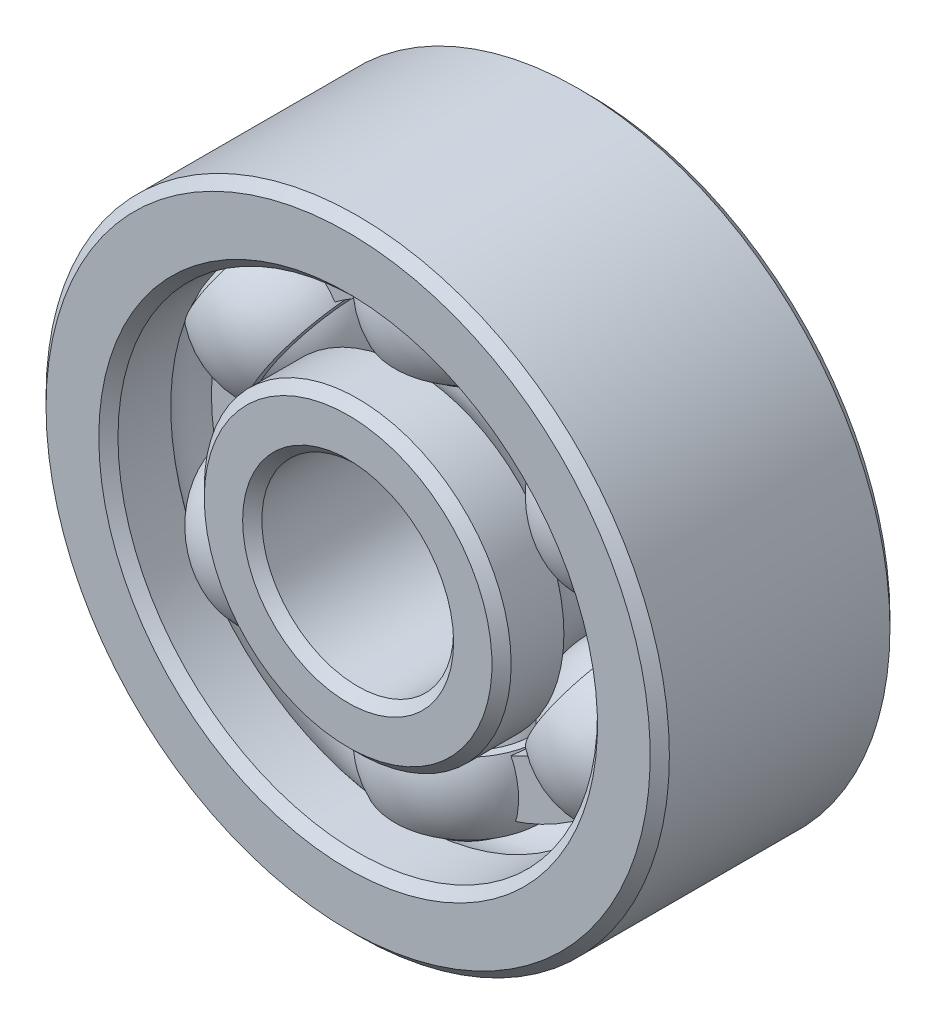
from build123d import *

# Parameters (mm, degrees)
CIRPATTERN1_COUNT = 6
CIRPATTERN2_COUNT = 6
EXTRUDE1_DEPTH    = 0.55
CIRPATTERN4_COUNT = 6
CHAMFER1_SIZE     = 0.2
CHAMFER_1_SIZE    = 0.2


with BuildPart() as part:
    # Sketch1 → Revolve1 (revolve)
    with BuildSketch(Plane(origin=(0, 0, 0), x_dir=(0, 0, -1), z_dir=(1, 0, 0))):
        with BuildLine():
            Line((-2.5, 6.5), (2.5, 6.5))
            Line((2.5, 6.5), (2.5, 5))
            Line((2.5, 5), (1.2, 5))
            ThreePointArc((1.2, 5), (0, 5.6), (-1.2, 5))
            Line((-1.2, 5), (-2.5, 5))
            Line((-2.5, 5), (-2.5, 6.5))
        make_face()
        with BuildLine():
            Line((-2.5, 3.2), (-1.2, 3.2))
            ThreePointArc((-1.2, 3.2), (0, 2.6), (1.2, 3.2))
            Line((1.2, 3.2), (2.5, 3.2))
            Line((2.5, 3.2), (2.5, 2))
            Line((2.5, 2), (-2.5, 2))
            Line((-2.5, 2), (-2.5, 3.2))
        make_face()
    revolve(axis=Axis((0, 0, 0), (0, 0, -1)))

    # Chamfer1
    chamfer1_edges = [part.edges().sort_by_distance(p)[0] for p in [
        (0, -2, -2.5),
        (0, -3.2, -2.5),
        (0, -3.2, 2.5),
        (0, -2, 2.5),
    ]]
    chamfer(chamfer1_edges, length=CHAMFER1_SIZE)

    # Фаска1
    chamfer_1_edges = [part.edges().sort_by_distance(p)[0] for p in [
        (0, -6.5, 2.5),
        (0, -5, 2.5),
        (0, -5, -2.5),
        (0, -6.5, -2.5),
    ]]
    chamfer(chamfer_1_edges, length=CHAMFER_1_SIZE)


with BuildPart() as body_2:
    # Sketch2 → Revolve2 (revolve)
    with BuildSketch(Plane(origin=(0, 0, 0), x_dir=(0, 0, -1), z_dir=(1, 0, 0))):
        with BuildLine():
            Line((0, 2.5873), (0, 5.6127))
            ThreePointArc((0, 5.6127), (1.5127, 4.1), (0, 2.5873))
        make_face()
    revolve(axis=Axis((0, 2.5873, 0), (0, 1, 0)))


with BuildPart() as cirpattern1_1:
    # CirPattern1: pattern copy
    add(body_2.part.rotate(Axis((0, 0, 0), (0, 0, 1)), 1 * 360 / CIRPATTERN1_COUNT))


with BuildPart() as cirpattern1_2:
    # CirPattern1: pattern copy
    add(body_2.part.rotate(Axis((0, 0, 0), (0, 0, 1)), 2 * 360 / CIRPATTERN1_COUNT))


with BuildPart() as cirpattern1_3:
    # CirPattern1: pattern copy
    add(body_2.part.rotate(Axis((0, 0, 0), (0, 0, 1)), 3 * 360 / CIRPATTERN1_COUNT))


with BuildPart() as cirpattern1_4:
    # CirPattern1: pattern copy
    add(body_2.part.rotate(Axis((0, 0, 0), (0, 0, 1)), 4 * 360 / CIRPATTERN1_COUNT))


with BuildPart() as cirpattern1_5:
    # CirPattern1: pattern copy
    add(body_2.part.rotate(Axis((0, 0, 0), (0, 0, 1)), 5 * 360 / CIRPATTERN1_COUNT))


with BuildPart() as body_8:
    # Sketch3 → Revolve3 (revolve)
    with BuildSketch(Plane(origin=(0, 0, 0), x_dir=(0, 0, -1), z_dir=(1, 0, 0))):
        with BuildLine():
            Line((1.356465997, 3.35), (1.52561463, 3.35))
            ThreePointArc((1.52561463, 3.35), (1.7, 4.1), (1.52561463, 4.85))
            Line((1.52561463, 4.85), (1.356465997, 4.85))
            ThreePointArc((1.356465997, 4.85), (1.55, 4.1), (1.356465997, 3.35))
        make_face()
    revolve(axis=Axis((0, 6.5, 0), (0, -1, 0)))


with BuildPart() as cirpattern2_1:
    # CirPattern2: pattern copy
    add(body_8.part.rotate(Axis((0, 0, 0), (0, 0, 1)), 1 * 360 / CIRPATTERN2_COUNT))


with BuildPart() as cirpattern2_2:
    # CirPattern2: pattern copy
    add(body_8.part.rotate(Axis((0, 0, 0), (0, 0, 1)), 2 * 360 / CIRPATTERN2_COUNT))


with BuildPart() as cirpattern2_3:
    # CirPattern2: pattern copy
    add(body_8.part.rotate(Axis((0, 0, 0), (0, 0, 1)), 3 * 360 / CIRPATTERN2_COUNT))


with BuildPart() as cirpattern2_4:
    # CirPattern2: pattern copy
    add(body_8.part.rotate(Axis((0, 0, 0), (0, 0, 1)), 4 * 360 / CIRPATTERN2_COUNT))


with BuildPart() as cirpattern2_5:
    # CirPattern2: pattern copy
    add(body_8.part.rotate(Axis((0, 0, 0), (0, 0, 1)), 5 * 360 / CIRPATTERN2_COUNT))


with BuildPart() as body_14:
    # Sketch5 → Extrude1 (new, symmetric)
    with BuildSketch(Plane.XY):
        with BuildLine():
            ThreePointArc((-1.4342904, 4.580699843), (-2.4, 4.156921938), (-3.249857231, 3.532481844))
            ThreePointArc((-3.249857231, 3.532481844), (-2.712261575, 3.309077174), (-2.298849246, 2.899188187))
            ThreePointArc((-2.298849246, 2.899188187), (-1.85, 3.204293994), (-1.361345997, 3.44045594))
            ThreePointArc((-1.361345997, 3.44045594), (-1.509614108, 4.003426013), (-1.4342904, 4.580699843))
        make_face()
    extrude(amount=EXTRUDE1_DEPTH, both=True)


with BuildPart() as cirpattern4_1:
    # CirPattern4: pattern copy
    add(body_14.part.rotate(Axis((0, 0, 0), (0, 0, -1)), 1 * 360 / CIRPATTERN4_COUNT))


with BuildPart() as cirpattern4_2:
    # CirPattern4: pattern copy
    add(body_14.part.rotate(Axis((0, 0, 0), (0, 0, -1)), 2 * 360 / CIRPATTERN4_COUNT))


with BuildPart() as cirpattern4_3:
    # CirPattern4: pattern copy
    add(body_14.part.rotate(Axis((0, 0, 0), (0, 0, -1)), 3 * 360 / CIRPATTERN4_COUNT))


with BuildPart() as cirpattern4_4:
    # CirPattern4: pattern copy
    add(body_14.part.rotate(Axis((0, 0, 0), (0, 0, -1)), 4 * 360 / CIRPATTERN4_COUNT))


with BuildPart() as cirpattern4_5:
    # CirPattern4: pattern copy
    add(body_14.part.rotate(Axis((0, 0, 0), (0, 0, -1)), 5 * 360 / CIRPATTERN4_COUNT))


solid = Compound([part.part, body_2.part, cirpattern1_1.part, cirpattern1_2.part, cirpattern1_3.part, cirpattern1_4.part, cirpattern1_5.part, body_8.part, cirpattern2_1.part, cirpattern2_2.part, cirpattern2_3.part, cirpattern2_4.part, cirpattern2_5.part, body_14.part, cirpattern4_1.part, cirpattern4_2.part, cirpattern4_3.part, cirpattern4_4.part, cirpattern4_5.part])
